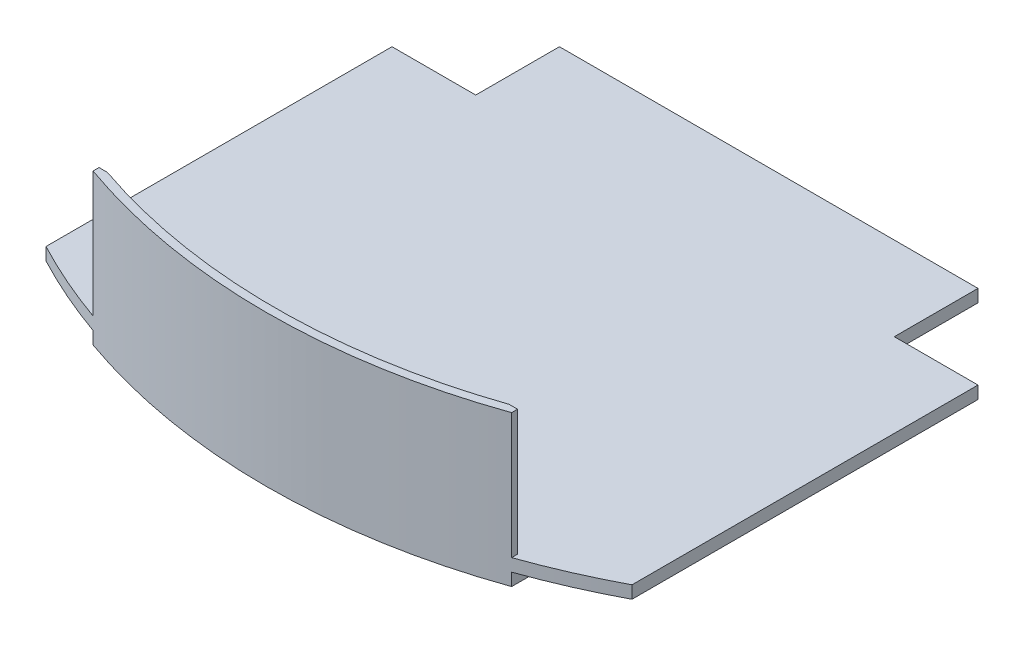
from build123d import *

# Parameters (mm, degrees)
BOSS_EXTRUDE1_DEPTH = 6
BOSS_EXTRUDE2_DEPTH = 30
CUT_EXTRUDE1_DEPTH  = 3
CUT_EXTRUDE2_DEPTH  = 3
SKETCH6_W           = 100
SKETCH6_H           = 20
CUT_EXTRUDE3_DEPTH  = 3
SHELL4_START        = 2
SHELL4_DEPTH        = 34
CUT_EXTRUDE4_REACH  = 197.438
SKETCH7_W           = 90
SKETCH7_H           = 30
BOSS_EXTRUDE3_DEPTH = 6


# Read off the part's stored shape, not the designer's step: Shell4
with BuildPart() as part:
    # Sketch2 → Boss-Extrude1 (new body)
    with BuildSketch(Plane(origin=(0, 0, 0), x_dir=(1, 0, 0), z_dir=(0, 1, 0))):
        with BuildLine():
            Line((50, -50), (0, -50))
            Line((0, -50), (-50, -50))
            Line((-50, -50), (-50, -141.421356237))
            ThreePointArc((-50, -141.421356237), (0, -150), (50, -141.421356237))
            Line((50, -141.421356237), (50, -50))
        make_face()
        with BuildLine():
            Line((-50, -141.421356237), (-50, -50))
            Line((-50, -50), (-70, -50))
            Line((-70, -50), (-70, -132.664991614))
            ThreePointArc((-70, -132.664991614), (-60.159525267, -137.407538074), (-50, -141.421356237))
        make_face()
        with BuildLine():
            Line((70, -50), (50, -50))
            Line((50, -50), (50, -141.421356237))
            ThreePointArc((50, -141.421356237), (60.159525267, -137.407538074), (70, -132.664991614))
            Line((70, -132.664991614), (70, -50))
        make_face()
        Polygon((-50, -50), (0, -50), (50, -50), (50, -30), (-50, -30), align=None)
    extrude(amount=BOSS_EXTRUDE1_DEPTH)

    # Sketch3 → Boss-Extrude2 (add)
    with BuildSketch(Plane(origin=(0, 6, 0), x_dir=(-1, 0, 0), z_dir=(0, 1, 0))):
        with BuildLine():
            Line((50, 50), (-50, 50))
            Line((-50, 50), (-50, 141.421356237))
            ThreePointArc((-50, 141.421356237), (0, 150), (50, 141.421356237))
            Line((50, 141.421356237), (50, 50))
        make_face()
    extrude(amount=BOSS_EXTRUDE2_DEPTH)

    # Sketch4 → Cut-Extrude1 (cut)
    with BuildSketch(Plane.XZ):
        with BuildLine():
            Line((-50, 141.421356237), (-50, 50))
            Line((-50, 50), (-70, 50))
            Line((-70, 50), (-70, 132.664991614))
            ThreePointArc((-70, 132.664991614), (-60.159525267, 137.407538074), (-50, 141.421356237))
        make_face()
    extrude(amount=-CUT_EXTRUDE1_DEPTH, mode=Mode.SUBTRACT)

    # Sketch5 → Cut-Extrude2 (cut)
    with BuildSketch(Plane.XZ):
        with BuildLine():
            Line((50, 141.421356237), (50, 50))
            Line((50, 50), (70, 50))
            Line((70, 50), (70, 132.664991614))
            ThreePointArc((70, 132.664991614), (60.159525267, 137.407538074), (50, 141.421356237))
        make_face()
    extrude(amount=-CUT_EXTRUDE2_DEPTH, mode=Mode.SUBTRACT)

    # Sketch6 → Cut-Extrude3 (cut)
    with BuildSketch(Plane.XZ):
        with Locations((0, 40)):
            Rectangle(SKETCH6_W, SKETCH6_H)
    extrude(amount=-CUT_EXTRUDE3_DEPTH, mode=Mode.SUBTRACT)

    # Shell4 outline → Shell4 (cut)
    with BuildSketch(Plane(origin=(0, 0, 0), x_dir=(1, 0, 0), z_dir=(0, 1, 0)).offset(SHELL4_START)):
        with BuildLine():
            Line((-48, -52), (-48, -140))
            ThreePointArc((-48, -140), (0, -148), (48, -140))
            Line((48, -140), (48, -52))
            Line((48, -52), (-48, -52))
        make_face()
    extrude(amount=SHELL4_DEPTH, mode=Mode.SUBTRACT)

    # Sketch7 → Cut-Extrude4 (cut, up to next)
    with BuildSketch(Plane.ZY.offset(50), mode=Mode.PRIVATE) as cut_extrude4_sk1:
        with Locations((95, 21)):
            Rectangle(SKETCH7_W, SKETCH7_H)
    cut_extrude4_tool1 = extrude(cut_extrude4_sk1.sketch, amount=-CUT_EXTRUDE4_REACH, mode=Mode.PRIVATE) & part.part
    add(cut_extrude4_tool1.solids().sort_by_distance((-50, 21, 95))[0], mode=Mode.SUBTRACT)

    # Sketch8 → Boss-Extrude3 (add)
    with BuildSketch(Plane.XZ):
        with BuildLine():
            Line((-48, 140), (-48, 52))
            Line((-48, 52), (48, 52))
            Line((48, 52), (48, 140))
            ThreePointArc((48, 140), (0, 148), (-48, 140))
        make_face()
    extrude(amount=-BOSS_EXTRUDE3_DEPTH)


solid = part.part
